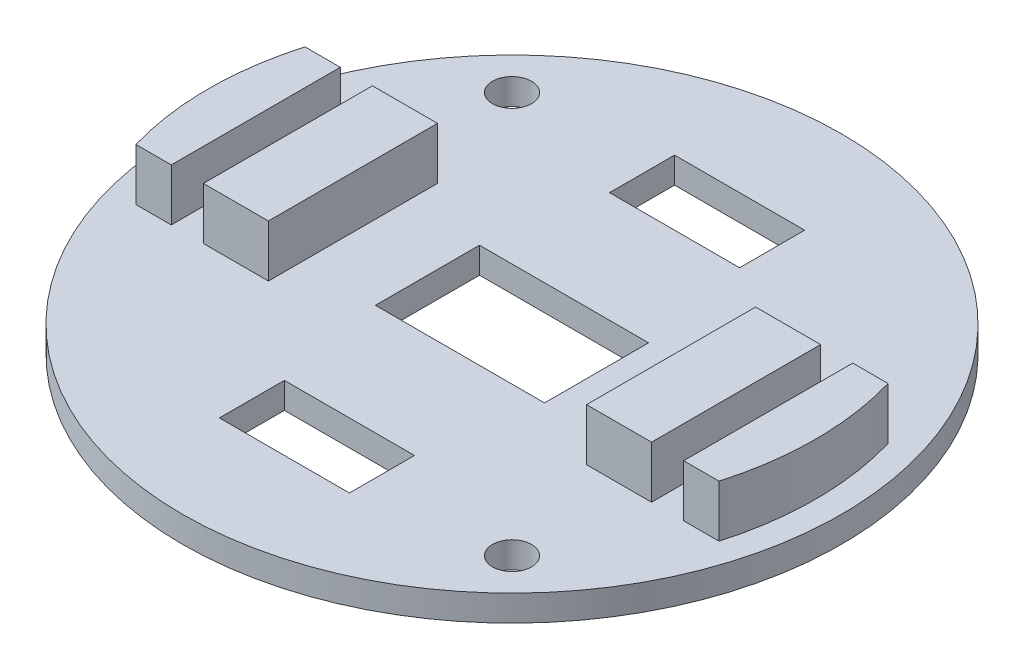
from build123d import *

# Parameters (mm, degrees)
SKETCH1_R           = 25.34
BOSS_EXTRUDE1_DEPTH = 2
SKETCH2_W           = 5
SKETCH2_H           = 13
BOSS_EXTRUDE2_DEPTH = 4
SKETCH3_R           = 1.5
CUT_EXTRUDE1_DEPTH  = 37.058718779
SKETCH4_W           = 10
SKETCH4_H           = 5
SKETCH4_W_2         = 13
SKETCH4_H_2         = 8
CUT_EXTRUDE2_DEPTH  = 37.058718779


with BuildPart() as part:
    # Sketch1 → Boss-Extrude1 (new body)
    with BuildSketch(Plane(origin=(0, 0, 0), x_dir=(1, 0, 0), z_dir=(0, 1, 0))):
        Circle(SKETCH1_R)
    extrude(amount=BOSS_EXTRUDE1_DEPTH)

    # Sketch2 → Boss-Extrude2 (add)
    with BuildSketch(Plane(origin=(0, 2, 0), x_dir=(1, 0, 0), z_dir=(0, 1, 0))):
        with Locations((14.73, 0)):
            Rectangle(SKETCH2_W, SKETCH2_H)
        with BuildLine():
            Line((22.416636679, 6.5), (19.7, 6.5))
            Line((19.7, 6.5), (19.7, -6.5))
            Line((19.7, -6.5), (22.416636679, -6.5))
            ThreePointArc((22.416636679, -6.5), (23.34, 0), (22.416636679, 6.5))
        make_face()
        with BuildLine():
            Line((-19.7, -6.5), (-22.416636679, -6.5))
            ThreePointArc((-22.416636679, -6.5), (-23.34, 0), (-22.416636679, 6.5))
            Line((-22.416636679, 6.5), (-19.7, 6.5))
            Line((-19.7, 6.5), (-19.7, -6.5))
        make_face()
        with Locations((-14.73, 0)):
            Rectangle(SKETCH2_W, SKETCH2_H)
    extrude(amount=BOSS_EXTRUDE2_DEPTH)

    # Sketch3 → Cut-Extrude1 (cut, through all)
    with BuildSketch(Plane(origin=(0, 2, 0), x_dir=(1, 0, 0), z_dir=(0, 1, 0))):
        with Locations((-15.421998898, 15.421998898)):
            Circle(SKETCH3_R)
        with Locations((15.421998898, -15.421998898)):
            Circle(SKETCH3_R)
    extrude(amount=-CUT_EXTRUDE1_DEPTH, mode=Mode.SUBTRACT)

    # Sketch4 → Cut-Extrude2 (cut, through all)
    with BuildSketch(Plane(origin=(0, 2, 0), x_dir=(1, 0, 0), z_dir=(0, 1, 0))):
        with Locations((0, 15)):
            Rectangle(SKETCH4_W, SKETCH4_H)
        with Locations((0, -15)):
            Rectangle(SKETCH4_W, SKETCH4_H)
        Rectangle(SKETCH4_W_2, SKETCH4_H_2)
    extrude(amount=-CUT_EXTRUDE2_DEPTH, mode=Mode.SUBTRACT)


solid = part.part
